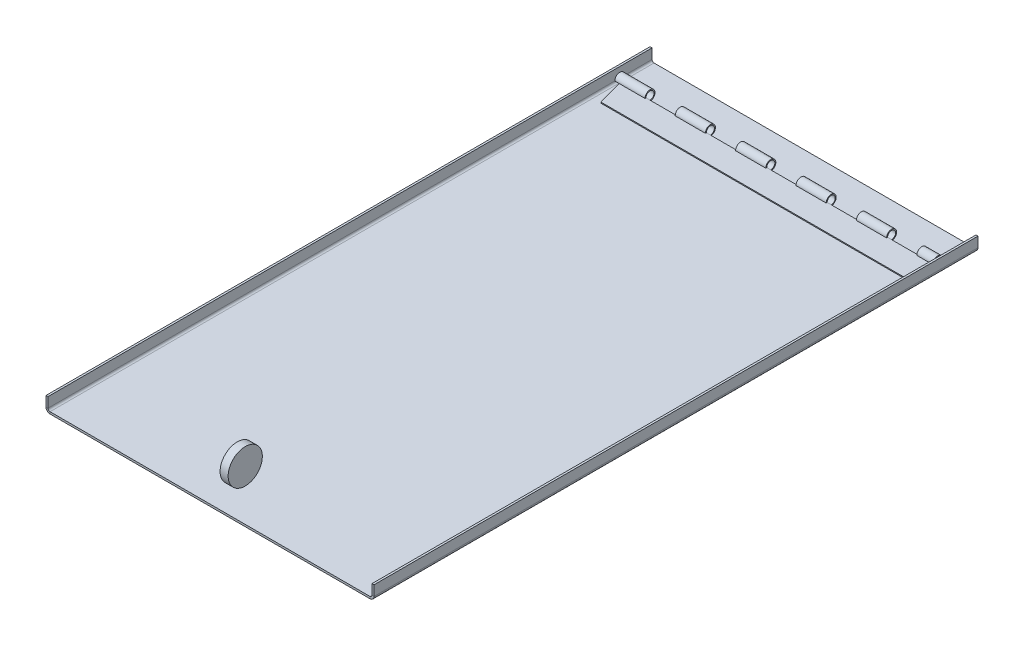
from build123d import *

# Parameters (mm, degrees)
EXTRUDE_1_DEPTH                    = 0.5
OTHER_START                        = -78.955969349
OTHER_1_DEPTH                      = 15
PATTERN_LINEAR_2_COUNT             = 5
PATTERN_LINEAR_2_PITCH             = 30
OTHER_START_2                      = 71.044030651
OTHER_3_DEPTH                      = 7.911938698
SKETCH_14_W                        = 160.911938698
SKETCH_14_H                        = 300
SM_BASE_FLANGE_1_DEPTH             = 1
SM_EDGE_FLANGE_1_STRIP_W           = 6
SM_EDGE_FLANGE_1_STRIP_H           = 1
SM_EDGE_FLANGE_1_STRIP_CUT_DEPTH   = 300
SM_EDGE_FLANGE_1_STRIP_2_W         = 6
SM_EDGE_FLANGE_1_STRIP_2_H         = 1
SM_EDGE_FLANGE_1_STRIP_CUT_2_DEPTH = 300
SM_EDGE_FLANGE_1_DEPTH             = 300
SM_EDGE_FLANGE_1_BEND_DEPTH        = 300
EXTRUDE_2_DEPTH                    = 2
EXTRUDE_2_DEPTH_BACK               = 2
SKETCH_23_R                        = 8.5


# Read off the part's stored shape, not the designer's step: Каемка1, Каемка3
# Sheet-metal steps are written as plain solids
with BuildPart() as part:
    # Sketch 1 → Бобышка-Вытянуть1 (new body)
    with BuildSketch(Plane(origin=(0, 0, 0), x_dir=(1, 0, 0), z_dir=(0, 1, 0))):
        Polygon((-78.955969349, 235.281709088), (78.955969349, 235.281709088), (75.399475479, 222.281709088), (-75.399475479, 222.281709088), align=None)
    extrude(amount=EXTRUDE_1_DEPTH)

    # Other 1 outline → Other 1 (add)
    with BuildSketch(Plane.YZ.offset(OTHER_START)):
        with BuildLine():
            Line((2.5, -232.781709088), (2.5, -233.281709088))
            ThreePointArc((2.5, -233.281709088), (3.914213562, -236.69592265), (0.5, -235.281709088))
            Line((0.5, -235.281709088), (0, -235.281709088))
            ThreePointArc((0, -235.281709088), (4.267766953, -237.049476041), (2.5, -232.781709088))
        make_face()
    other_1 = extrude(amount=OTHER_1_DEPTH)

    # Линейный массив2: Other 1 ×5
    with Locations(*[(i * PATTERN_LINEAR_2_PITCH, 0, 0) for i in range(1, PATTERN_LINEAR_2_COUNT)]):
        add(other_1)

    # Other 3 outline → Other 3 (add)
    with BuildSketch(Plane.YZ.offset(OTHER_START_2)):
        with BuildLine():
            Line((2.5, -232.781709088), (2.5, -233.281709088))
            ThreePointArc((2.5, -233.281709088), (3.914213562, -236.69592265), (0.5, -235.281709088))
            Line((0.5, -235.281709088), (0, -235.281709088))
            ThreePointArc((0, -235.281709088), (4.267766953, -237.049476041), (2.5, -232.781709088))
        make_face()
    extrude(amount=OTHER_3_DEPTH)


with BuildPart() as body_2:
    # Эскиз14 → Базовая кромка1 (new body)
    with BuildSketch(Plane.XZ):
        with Locations((0, -102.781709088)):
            Rectangle(SKETCH_14_W, SKETCH_14_H)
    extrude(amount=SM_BASE_FLANGE_1_DEPTH)

    # Ребро-кромка1 strip (across the edge) → Ребро-кромка1 strip cut (cut)
    with BuildSketch(Plane(origin=(-80.455969349, 0, -252.781709088), x_dir=(1, 0, 0), z_dir=(0, 0, 1))):
        with Locations((-2, -0.5)):
            Rectangle(SM_EDGE_FLANGE_1_STRIP_W, SM_EDGE_FLANGE_1_STRIP_H)
    extrude(amount=SM_EDGE_FLANGE_1_STRIP_CUT_DEPTH, mode=Mode.SUBTRACT)

    # Ребро-кромка1 strip 2 (across the edge) → Ребро-кромка1 strip cut 2 (cut)
    with BuildSketch(Plane(origin=(80.455969349, 0, 47.218290912), x_dir=(-1, 0, 0), z_dir=(0, 0, -1))):
        with Locations((-2, -0.5)):
            Rectangle(SM_EDGE_FLANGE_1_STRIP_2_W, SM_EDGE_FLANGE_1_STRIP_2_H)
    extrude(amount=SM_EDGE_FLANGE_1_STRIP_CUT_2_DEPTH, mode=Mode.SUBTRACT)

    # Ребро-кромка1 section (across the edge) → Ребро-кромка1 (add)
    with BuildSketch(Plane(origin=(-80.455969349, 0, -252.781709088), x_dir=(1, 0, 0), z_dir=(0, 0, 1))):
        with BuildLine():
            Line((-1, 1), (-1, 6))
            Line((-1, 6), (0, 6))
            Line((0, 6), (0, 1))
            ThreePointArc((0, 1), (0.292893219, 0.292893219), (1, 0))
            Line((1, 0), (1, -1))
            ThreePointArc((1, -1), (-0.414213562, -0.414213562), (-1, 1))
        make_face()
    extrude(amount=SM_EDGE_FLANGE_1_DEPTH)

    # Ребро-кромка1 section 2 (across the edge) → Ребро-кромка1 bend (add)
    with BuildSketch(Plane(origin=(80.455969349, 0, 47.218290912), x_dir=(-1, 0, 0), z_dir=(0, 0, -1))):
        with BuildLine():
            Line((-1, 1), (-1, 6))
            Line((-1, 6), (0, 6))
            Line((0, 6), (0, 1))
            ThreePointArc((0, 1), (0.292893219, 0.292893219), (1, 0))
            Line((1, 0), (1, -1))
            ThreePointArc((1, -1), (-0.414213562, -0.414213562), (-1, 1))
        make_face()
    extrude(amount=SM_EDGE_FLANGE_1_BEND_DEPTH)


with BuildPart() as body_3:
    # Эскиз23 → Бобышка-Вытянуть2 (new, two sides: drawn at the far end of the back side and taken through both)
    with BuildSketch(Plane(origin=(0, 0, 0), x_dir=(0, 0, -1), z_dir=(1, 0, 0)).offset(-EXTRUDE_2_DEPTH_BACK)):
        with Locations((-31.718290912, 9.5)):
            Circle(SKETCH_23_R)
    extrude(amount=EXTRUDE_2_DEPTH + EXTRUDE_2_DEPTH_BACK)


solid = Compound([part.part, body_2.part, body_3.part])
